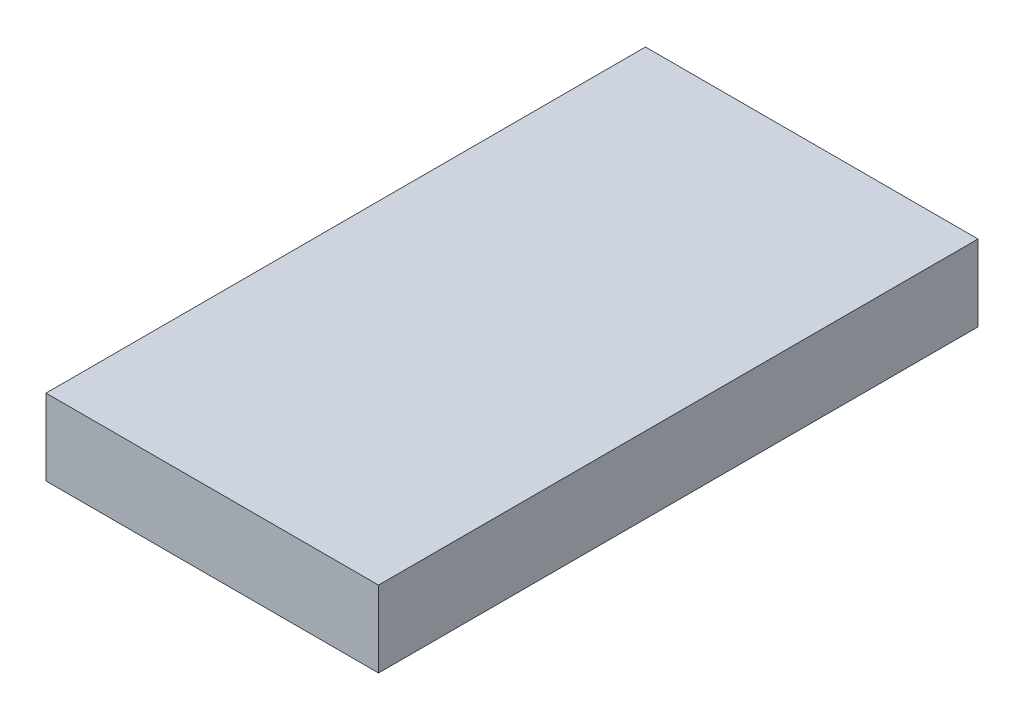
from build123d import *

# Parameters (mm, degrees)
SKETCH1_W           = 55.47
SKETCH1_H           = 100
BOSS_EXTRUDE1_DEPTH = 12.7


with BuildPart() as part:
    # Sketch1 → Boss-Extrude1 (new body)
    with BuildSketch(Plane(origin=(0, 0, 0), x_dir=(1, 0, 0), z_dir=(0, 1, 0))):
        Rectangle(SKETCH1_W, SKETCH1_H)
    extrude(amount=BOSS_EXTRUDE1_DEPTH)


solid = part.part
